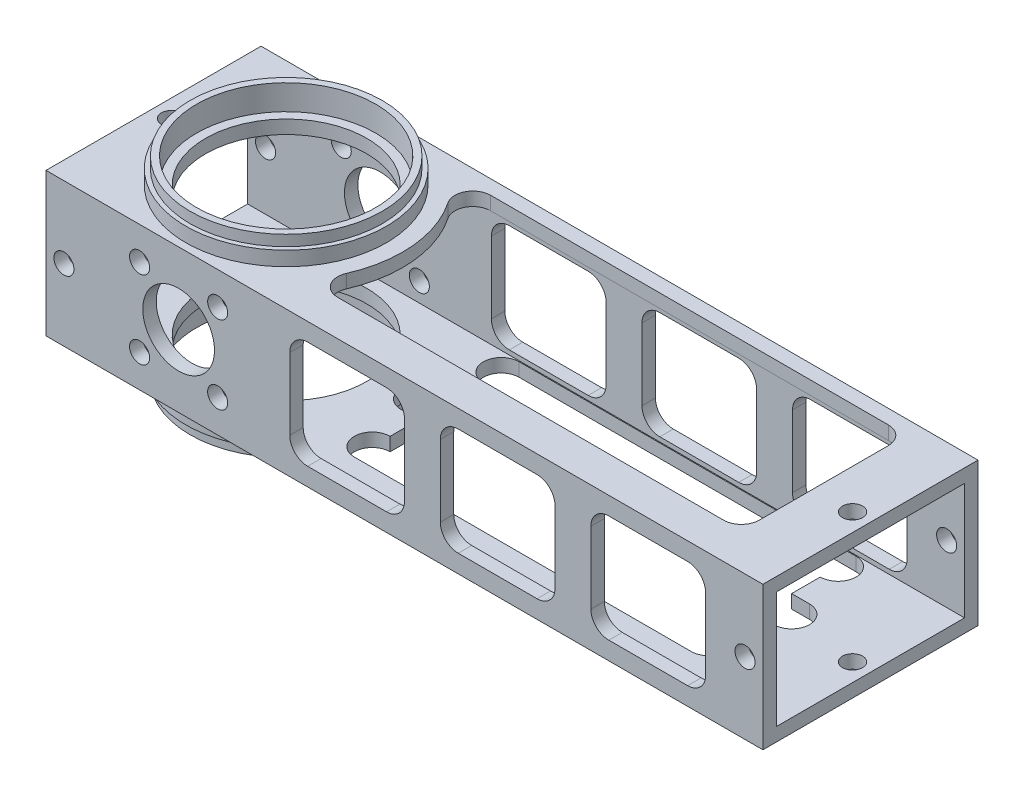
from build123d import *

# Parameters (mm, degrees)
SKETCH1_W                            = 38.1
SKETCH1_H                            = 25.4
SKETCH1_W_2                          = 33.3375
SKETCH1_H_2                          = 20.6375
BOSS_EXTRUDE1_DEPTH                  = 127
SKETCH2_R                            = 14.2875
CUT_EXTRUDE1_DEPTH                   = 136.002851822
SKETCH3_R                            = 6.35
SKETCH3_R_2                          = 1.778
CUT_EXTRUDE2_DEPTH                   = 136.002851822
CUT_EXTRUDE3_REACH                   = 137.003
F_4_0_209_DIAMETER_HOLE1_D           = 3.556
F_4_0_209_DIAMETER_HOLE1_ON_FACE_2_D = 3.556
F_4_0_209_DIAMETER_HOLE1_ON_FACE_3_D = 3.556
F_4_0_209_DIAMETER_HOLE1_ON_FACE_4_D = 3.556
CUT_EXTRUDE4_REACH                   = 137.003


with BuildPart() as part:
    # Sketch1 → Boss-Extrude1 (new body)
    with BuildSketch(Plane(origin=(0, 0, 0), x_dir=(0, 0, -1), z_dir=(1, 0, 0))):
        with Locations((19.05, 12.7)):
            Rectangle(SKETCH1_W, SKETCH1_H)
        with Locations((19.05, 12.7)):
            Rectangle(SKETCH1_W_2, SKETCH1_H_2, mode=Mode.SUBTRACT)
    extrude(amount=BOSS_EXTRUDE1_DEPTH)

    # Sketch2 → Cut-Extrude1 (cut, through all)
    with BuildSketch(Plane(origin=(0, 25.4, 0), x_dir=(1, 0, 0), z_dir=(0, 1, 0))):
        with Locations((23.495, 19.05)):
            Circle(SKETCH2_R)
    extrude(amount=-CUT_EXTRUDE1_DEPTH, mode=Mode.SUBTRACT)

    # Sketch3 → Cut-Extrude2 (cut, through all)
    with BuildSketch(Plane.XY):
        with Locations((23.495, 12.7)):
            Circle(SKETCH3_R)
        with Locations((16.580202787, 19.614797213)):
            Circle(SKETCH3_R_2)
        with Locations((16.580202787, 5.785202787)):
            Circle(SKETCH3_R_2)
        with Locations((30.409797213, 5.785202787)):
            Circle(SKETCH3_R_2)
        with Locations((30.409797213, 19.614797213)):
            Circle(SKETCH3_R_2)
        with BuildLine():
            Line((46.355, 22.225), (60.325, 22.225))
            ThreePointArc((60.325, 22.225), (62.57006403, 21.29506403), (63.5, 19.05))
            Line((63.5, 19.05), (63.5, 6.35))
            ThreePointArc((63.5, 6.35), (62.57006403, 4.10493597), (60.325, 3.175))
            Line((60.325, 3.175), (46.355, 3.175))
            ThreePointArc((46.355, 3.175), (44.10993597, 4.10493597), (43.18, 6.35))
            Line((43.18, 6.35), (43.18, 19.05))
            ThreePointArc((43.18, 19.05), (44.10993597, 21.29506403), (46.355, 22.225))
        make_face()
        with BuildLine():
            Line((73.025, 22.225), (86.995, 22.225))
            ThreePointArc((86.995, 22.225), (89.24006403, 21.29506403), (90.17, 19.05))
            Line((90.17, 19.05), (90.17, 6.35))
            ThreePointArc((90.17, 6.35), (89.24006403, 4.10493597), (86.995, 3.175))
            Line((86.995, 3.175), (73.025, 3.175))
            ThreePointArc((73.025, 3.175), (70.77993597, 4.10493597), (69.85, 6.35))
            Line((69.85, 6.35), (69.85, 19.05))
            ThreePointArc((69.85, 19.05), (70.77993597, 21.29506403), (73.025, 22.225))
        make_face()
        with BuildLine():
            Line((99.695, 22.225), (113.665, 22.225))
            ThreePointArc((113.665, 22.225), (115.91006403, 21.29506403), (116.84, 19.05))
            Line((116.84, 19.05), (116.84, 6.35))
            ThreePointArc((116.84, 6.35), (115.91006403, 4.10493597), (113.665, 3.175))
            Line((113.665, 3.175), (99.695, 3.175))
            ThreePointArc((99.695, 3.175), (97.44993597, 4.10493597), (96.52, 6.35))
            Line((96.52, 6.35), (96.52, 19.05))
            ThreePointArc((96.52, 19.05), (97.44993597, 21.29506403), (99.695, 22.225))
        make_face()
    extrude(amount=-CUT_EXTRUDE2_DEPTH, mode=Mode.SUBTRACT)

    # Sketch4 → Cut-Extrude3 (cut, up to next)
    with BuildSketch(Plane(origin=(0, 25.4, 0), x_dir=(1, 0, 0), z_dir=(0, 1, 0)), mode=Mode.PRIVATE) as cut_extrude3_sk1:
        with BuildLine():
            Line((45.319516747, 6.35), (113.665, 6.35))
            ThreePointArc((113.665, 6.35), (115.91006403, 7.27993597), (116.84, 9.525))
            Line((116.84, 9.525), (116.84, 32.385))
            ThreePointArc((116.84, 32.385), (115.91006403, 34.63006403), (113.665, 35.56))
            Line((113.665, 35.56), (43.223480206, 35.56))
            ThreePointArc((43.223480206, 35.56), (40.419396131, 33.874207004), (40.593016179, 30.607))
            ThreePointArc((40.593016179, 30.607), (44.046292615, 20.934350844), (42.409581181, 10.795))
            ThreePointArc((42.409581181, 10.795), (42.663121163, 7.78598088), (45.319516747, 6.35))
        make_face()
    cut_extrude3_tool1 = extrude(cut_extrude3_sk1.sketch, amount=-CUT_EXTRUDE3_REACH, mode=Mode.PRIVATE) & part.part
    add(cut_extrude3_tool1.solids().sort_by_distance((79.681448, 25.4, -21.040871))[0], mode=Mode.SUBTRACT)

    # #4 (0.209) Diameter Hole1 (through all)
    with Locations(Plane(origin=(3.175, 25.4, -19.05), x_dir=(0, 0, 1), z_dir=(0, 1, 0))):
        with Locations((0, 0), (0, 120.65)):
            Hole(F_4_0_209_DIAMETER_HOLE1_D / 2)

    # #4 (0.209) Diameter Hole1 on face 2 (through all)
    with Locations(Plane(origin=(123.825, 12.7, 0), x_dir=(1, 0, 0), z_dir=(0, 0, 1))):
        with Locations((0, 0), (-120.65, 0)):
            Hole(F_4_0_209_DIAMETER_HOLE1_ON_FACE_2_D / 2)

    # #4 (0.209) Diameter Hole1 on face 3 (through all)
    with Locations(Plane(origin=(123.825, 0, -19.05), x_dir=(0, 0, -1), z_dir=(0, -1, 0))):
        with Locations((0, 0), (0, -120.65)):
            Hole(F_4_0_209_DIAMETER_HOLE1_ON_FACE_3_D / 2)

    # #4 (0.209) Diameter Hole1 on face 4 (through all)
    with Locations(Plane(origin=(123.825, 12.7, -38.1), x_dir=(-1, 0, 0), z_dir=(0, 0, -1))):
        with Locations((0, 0), (120.65, 0)):
            Hole(F_4_0_209_DIAMETER_HOLE1_ON_FACE_4_D / 2)

    # Sketch6 → Cut-Extrude4 (cut, up to next)
    with BuildSketch(Plane.XZ, mode=Mode.PRIVATE) as cut_extrude4_sk1:
        with BuildLine():
            Line((48.26, -35.56), (107.95, -35.56))
            ThreePointArc((107.95, -35.56), (111.125, -32.385), (107.95, -29.21))
            Line((107.95, -29.21), (107.95, -24.13))
            Line((107.95, -24.13), (111.125, -24.13))
            ThreePointArc((111.125, -24.13), (114.3, -20.955), (111.125, -17.78))
            Line((111.125, -17.78), (107.95, -17.78))
            Line((107.95, -17.78), (107.95, -12.7))
            ThreePointArc((107.95, -12.7), (111.125, -9.525), (107.95, -6.35))
            Line((107.95, -6.35), (48.26, -6.35))
            ThreePointArc((48.26, -6.35), (45.085, -9.525), (48.26, -12.7))
            Line((48.26, -12.7), (48.26, -17.78))
            Line((48.26, -17.78), (45.085, -17.78))
            ThreePointArc((45.085, -17.78), (41.91, -20.955), (45.085, -24.13))
            Line((45.085, -24.13), (48.26, -24.13))
            Line((48.26, -24.13), (48.26, -29.21))
            ThreePointArc((48.26, -29.21), (45.085, -32.385), (48.26, -35.56))
        make_face()
    cut_extrude4_tool1 = extrude(cut_extrude4_sk1.sketch, amount=-CUT_EXTRUDE4_REACH, mode=Mode.PRIVATE) & part.part
    add(cut_extrude4_tool1.solids().sort_by_distance((78.105, 0, -20.955))[0], mode=Mode.SUBTRACT)

    # Sketch7 → Revolve1 (revolve)
    with BuildSketch(Plane.XY.offset(-19.05)):
        Polygon((39.37, 29.845), (39.37, 25.4), (41.275, 25.4), (41.275, 27.94), (40.513, 27.94), (40.513, 29.845), align=None)
        Polygon((39.37, -4.445), (39.37, 0), (41.275, 0), (41.275, -2.54), (40.513, -2.54), (40.513, -4.445), align=None)
    revolve(axis=Axis((23.495, -4.445, -19.05), (0, 1, 0)))


solid = part.part
